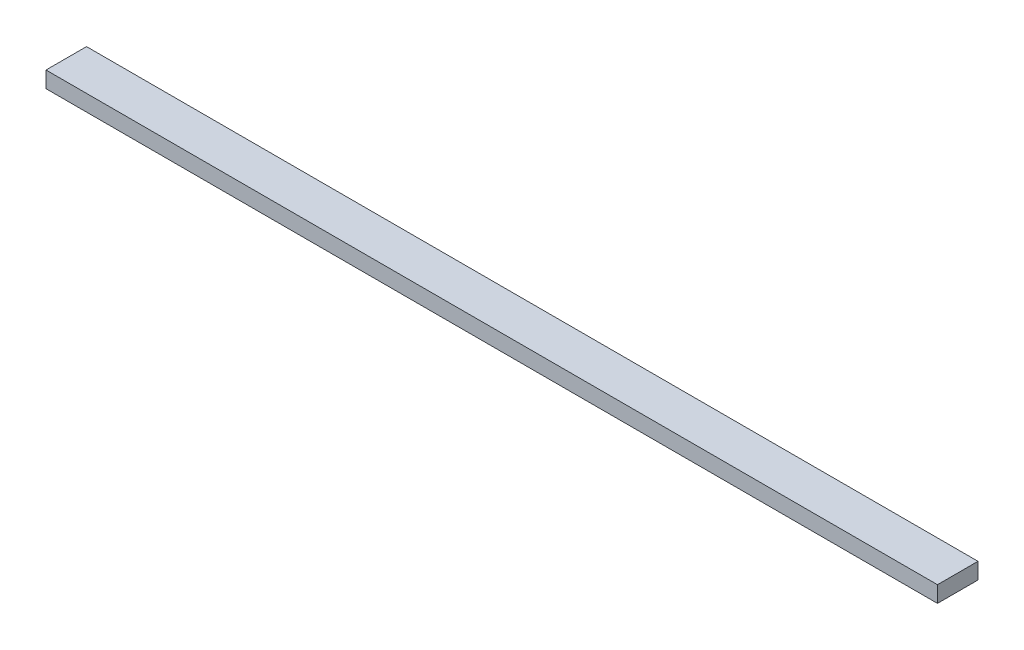
from build123d import *

# Parameters (mm, degrees)
SKETCH1_W           = 279.4
SKETCH1_H           = 12.7
BOSS_EXTRUDE1_DEPTH = 5.08


with BuildPart() as part:
    # Sketch1 → Boss-Extrude1 (new body)
    with BuildSketch(Plane(origin=(0, 0, 0), x_dir=(1, 0, 0), z_dir=(0, 1, 0))):
        Rectangle(SKETCH1_W, SKETCH1_H)
    extrude(amount=BOSS_EXTRUDE1_DEPTH)


solid = part.part
